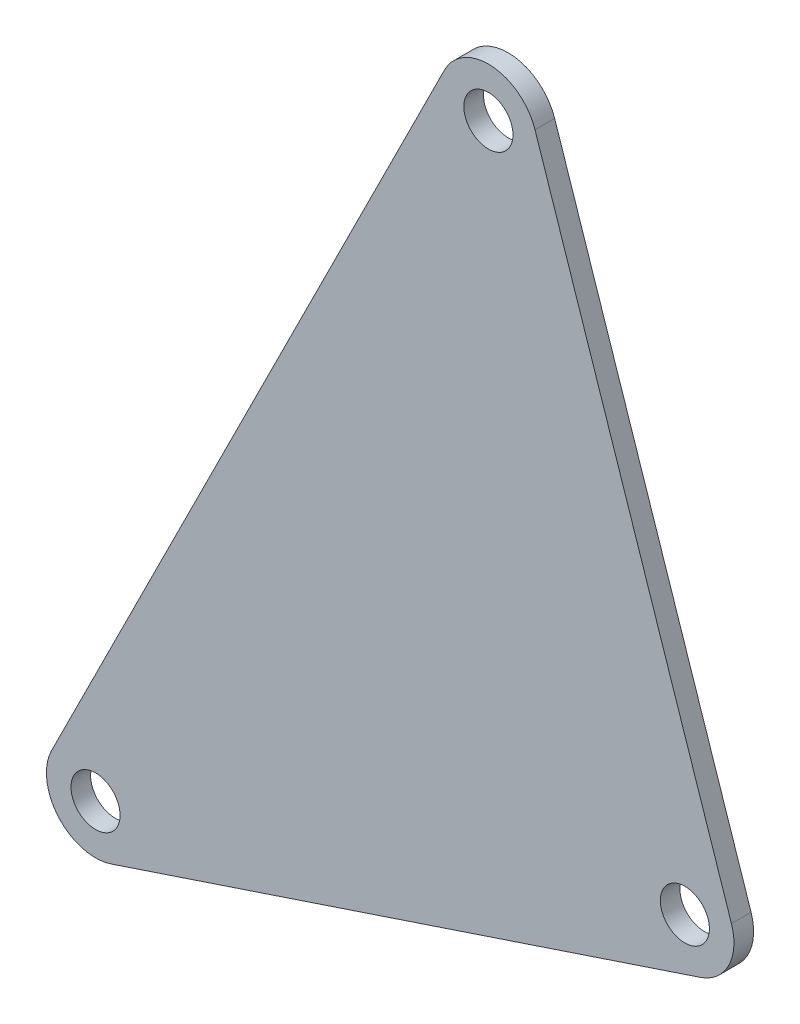
from build123d import *

# Parameters (mm, degrees)
SKETCH1_R           = 3.175
BOSS_EXTRUDE1_DEPTH = 2.54
FILLET1_R           = 6.35


with BuildPart() as part:
    # Sketch1 → Boss-Extrude1 (new body)
    with BuildSketch(Plane.XY):
        Polygon((-24.223713703, 118.151604251), (-88.735511623, -10.871991588), (8.032185257, 21.383907372), align=None)
        with Locations((-76.2, 0)):
            Circle(SKETCH1_R, mode=Mode.SUBTRACT)
        with Locations((0, 25.4)):
            Circle(SKETCH1_R, mode=Mode.SUBTRACT)
        with Locations((-25.4, 101.6)):
            Circle(SKETCH1_R, mode=Mode.SUBTRACT)
    extrude(amount=BOSS_EXTRUDE1_DEPTH)

    # Fillet1
    fillet1_edges = [part.edges().sort_by_distance(p)[0] for p in [
        (-88.735511623, -10.871991588, 1.27),
        (8.032185257, 21.383907372, 1.27),
        (-24.223713703, 118.151604251, 1.27),
    ]]
    fillet(fillet1_edges, radius=FILLET1_R)


solid = part.part
